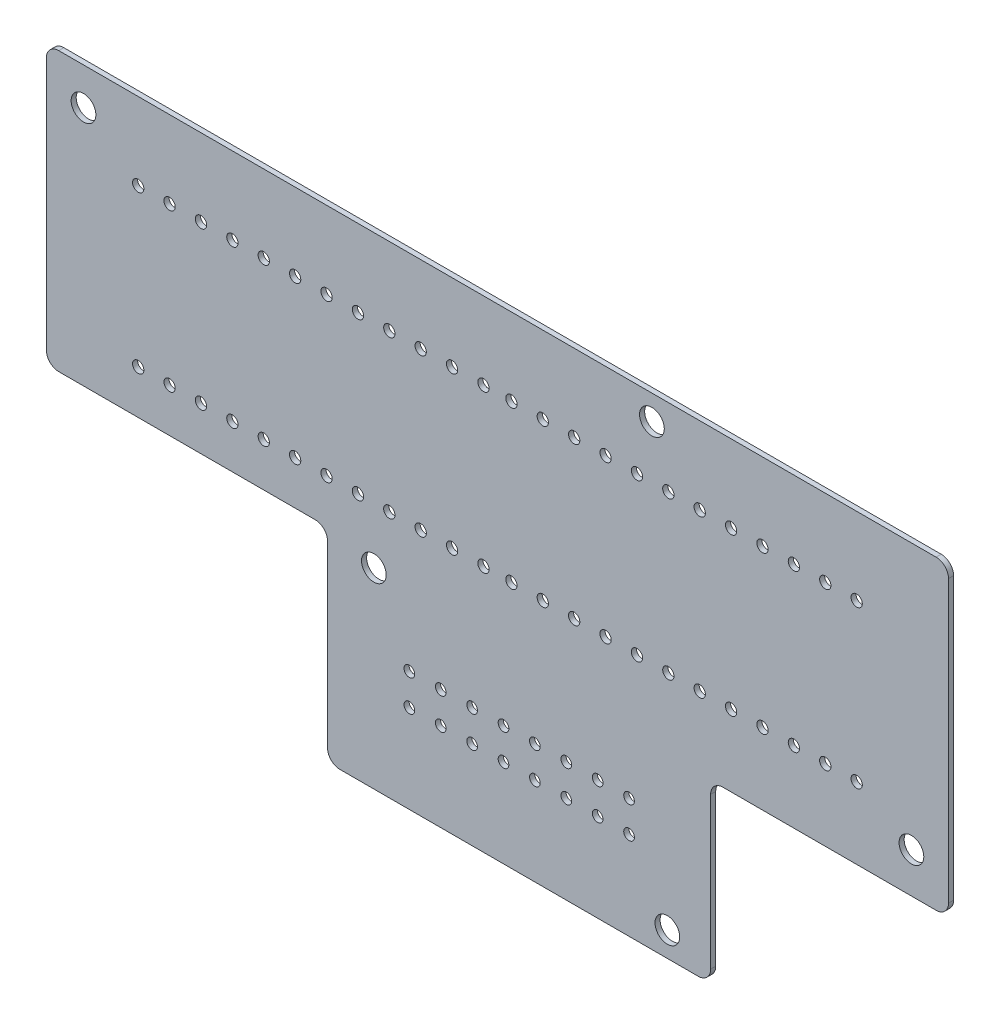
from build123d import *

# Parameters (mm, degrees)
BOARD_DEPTH                        = 0.41148
F_1_0_228_DIAMETER_HOLE1_OUTLINE_R = 0.4572
F_1_0_228_DIAMETER_HOLE1_DEPTH     = 0.41148
F_1_0_228_DIAMETER_HOLE2_OUTLINE_R = 0.4318
F_1_0_228_DIAMETER_HOLE2_DEPTH     = 0.41148
SKETCH6_R                          = 0.999998
CUT_EXTRUDE1_DEPTH                 = 77.389914621
SKETCH7_R                          = 0.999998
CUT_EXTRUDE2_DEPTH                 = 77.389914621
SKETCH8_R                          = 0.999998
CUT_EXTRUDE3_DEPTH                 = 77.389914621
SKETCH9_R                          = 0.999998
CUT_EXTRUDE4_DEPTH                 = 77.389914621
SKETCH10_R                         = 0.999998
CUT_EXTRUDE5_DEPTH                 = 77.389914621


# Read off the part's stored shape, not the designer's step: #1 (0.228) Diameter Hole1, #1 (0.228) Diameter Hole2
with BuildPart() as part:
    # Sketch1 → Board (new body)
    with BuildSketch(Plane.XY):
        with BuildLine():
            Line((0.999998, 22.49999818), (71.99999824, 22.49999564))
            ThreePointArc((71.99999824, 22.49999564), (72.707104877, 22.207103533), (72.99999878, 21.49999764))
            Line((72.99999878, 21.49999764), (72.99999624, -1.2499975))
            ThreePointArc((72.99999624, -1.2499975), (72.707104133, -1.957104137), (71.99999824, -2.24999804))
            Line((71.99999824, -2.24999804), (54.74999972, -2.25000058))
            ThreePointArc((54.74999972, -2.25000058), (54.042893083, -2.542892687), (53.74999918, -3.24999858))
            Line((53.74999918, -3.24999858), (53.74999664, -15.49999948))
            ThreePointArc((53.74999664, -15.49999948), (53.457104007, -16.207104847), (52.74999864, -16.49999748))
            Line((52.74999864, -16.49999748), (23.74999822, -16.49999748))
            ThreePointArc((23.74999822, -16.49999748), (23.042891583, -16.207105373), (22.74999768, -15.49999948))
            Line((22.74999768, -15.49999948), (22.74999768, -0.999998))
            ThreePointArc((22.74999768, -0.999998), (22.457105047, -0.292892633), (21.74999968, 0))
            Line((21.74999968, 0), (0.999998, 0))
            ThreePointArc((0.999998, 0), (0.292892633, 0.292892633), (0, 0.999998))
            Line((0, 0.999998), (-2.54e-06, 21.49999764))
            ThreePointArc((-2.54e-06, 21.49999764), (0.292890837, 22.207104803), (0.999998, 22.49999818))
        make_face()
    extrude(amount=BOARD_DEPTH)

    # #1 (0.228) Diameter Hole1 outline → #1 (0.228) Diameter Hole1 (cut)
    with BuildSketch(Plane.XY):
        with Locations((37.62799942, 16.24500434)):
            Circle(F_1_0_228_DIAMETER_HOLE1_OUTLINE_R)
        with Locations((40.16799942, 16.24500434)):
            Circle(F_1_0_228_DIAMETER_HOLE1_OUTLINE_R)
        with Locations((42.70799942, 16.24500434)):
            Circle(F_1_0_228_DIAMETER_HOLE1_OUTLINE_R)
        with Locations((45.24799942, 16.24500434)):
            Circle(F_1_0_228_DIAMETER_HOLE1_OUTLINE_R)
        with Locations((47.78799942, 16.24500434)):
            Circle(F_1_0_228_DIAMETER_HOLE1_OUTLINE_R)
        with Locations((50.32799942, 16.24500434)):
            Circle(F_1_0_228_DIAMETER_HOLE1_OUTLINE_R)
        with Locations((52.86799942, 16.24500434)):
            Circle(F_1_0_228_DIAMETER_HOLE1_OUTLINE_R)
        with Locations((55.40799942, 16.24500434)):
            Circle(F_1_0_228_DIAMETER_HOLE1_OUTLINE_R)
        with Locations((57.94799942, 16.24500434)):
            Circle(F_1_0_228_DIAMETER_HOLE1_OUTLINE_R)
        with Locations((60.48799942, 16.24500434)):
            Circle(F_1_0_228_DIAMETER_HOLE1_OUTLINE_R)
        with Locations((63.02799942, 16.24500434)):
            Circle(F_1_0_228_DIAMETER_HOLE1_OUTLINE_R)
        with Locations((65.56799942, 16.24500434)):
            Circle(F_1_0_228_DIAMETER_HOLE1_OUTLINE_R)
        with Locations((65.56799942, 3.54500434)):
            Circle(F_1_0_228_DIAMETER_HOLE1_OUTLINE_R)
        with Locations((63.02799942, 3.54500434)):
            Circle(F_1_0_228_DIAMETER_HOLE1_OUTLINE_R)
        with Locations((60.48799942, 3.54500434)):
            Circle(F_1_0_228_DIAMETER_HOLE1_OUTLINE_R)
        with Locations((57.94799942, 3.54500434)):
            Circle(F_1_0_228_DIAMETER_HOLE1_OUTLINE_R)
        with Locations((55.40799942, 3.54500434)):
            Circle(F_1_0_228_DIAMETER_HOLE1_OUTLINE_R)
        with Locations((52.86799942, 3.54500434)):
            Circle(F_1_0_228_DIAMETER_HOLE1_OUTLINE_R)
        with Locations((50.32799942, 3.54500434)):
            Circle(F_1_0_228_DIAMETER_HOLE1_OUTLINE_R)
        with Locations((47.78799942, 3.54500434)):
            Circle(F_1_0_228_DIAMETER_HOLE1_OUTLINE_R)
        with Locations((45.24799942, 3.54500434)):
            Circle(F_1_0_228_DIAMETER_HOLE1_OUTLINE_R)
        with Locations((42.70799942, 3.54500434)):
            Circle(F_1_0_228_DIAMETER_HOLE1_OUTLINE_R)
        with Locations((40.16799942, 3.54500434)):
            Circle(F_1_0_228_DIAMETER_HOLE1_OUTLINE_R)
        with Locations((37.62799942, 3.54500434)):
            Circle(F_1_0_228_DIAMETER_HOLE1_OUTLINE_R)
        with Locations((7.42800902, 16.24500434)):
            Circle(F_1_0_228_DIAMETER_HOLE1_OUTLINE_R)
        with Locations((9.96800902, 16.24500434)):
            Circle(F_1_0_228_DIAMETER_HOLE1_OUTLINE_R)
        with Locations((12.50800902, 16.24500434)):
            Circle(F_1_0_228_DIAMETER_HOLE1_OUTLINE_R)
        with Locations((15.04800902, 16.24500434)):
            Circle(F_1_0_228_DIAMETER_HOLE1_OUTLINE_R)
        with Locations((17.58800902, 16.24500434)):
            Circle(F_1_0_228_DIAMETER_HOLE1_OUTLINE_R)
        with Locations((20.12800902, 16.24500434)):
            Circle(F_1_0_228_DIAMETER_HOLE1_OUTLINE_R)
        with Locations((22.66800902, 16.24500434)):
            Circle(F_1_0_228_DIAMETER_HOLE1_OUTLINE_R)
        with Locations((25.20800902, 16.24500434)):
            Circle(F_1_0_228_DIAMETER_HOLE1_OUTLINE_R)
        with Locations((27.74800902, 16.24500434)):
            Circle(F_1_0_228_DIAMETER_HOLE1_OUTLINE_R)
        with Locations((30.28800902, 16.24500434)):
            Circle(F_1_0_228_DIAMETER_HOLE1_OUTLINE_R)
        with Locations((32.82800902, 16.24500434)):
            Circle(F_1_0_228_DIAMETER_HOLE1_OUTLINE_R)
        with Locations((35.36800902, 16.24500434)):
            Circle(F_1_0_228_DIAMETER_HOLE1_OUTLINE_R)
        with Locations((35.36800902, 3.54500434)):
            Circle(F_1_0_228_DIAMETER_HOLE1_OUTLINE_R)
        with Locations((32.82800902, 3.54500434)):
            Circle(F_1_0_228_DIAMETER_HOLE1_OUTLINE_R)
        with Locations((30.28800902, 3.54500434)):
            Circle(F_1_0_228_DIAMETER_HOLE1_OUTLINE_R)
        with Locations((27.74800902, 3.54500434)):
            Circle(F_1_0_228_DIAMETER_HOLE1_OUTLINE_R)
        with Locations((25.20800902, 3.54500434)):
            Circle(F_1_0_228_DIAMETER_HOLE1_OUTLINE_R)
        with Locations((22.66800902, 3.54500434)):
            Circle(F_1_0_228_DIAMETER_HOLE1_OUTLINE_R)
        with Locations((20.12800902, 3.54500434)):
            Circle(F_1_0_228_DIAMETER_HOLE1_OUTLINE_R)
        with Locations((17.58800902, 3.54500434)):
            Circle(F_1_0_228_DIAMETER_HOLE1_OUTLINE_R)
        with Locations((15.04800902, 3.54500434)):
            Circle(F_1_0_228_DIAMETER_HOLE1_OUTLINE_R)
        with Locations((12.50800902, 3.54500434)):
            Circle(F_1_0_228_DIAMETER_HOLE1_OUTLINE_R)
        with Locations((9.96800902, 3.54500434)):
            Circle(F_1_0_228_DIAMETER_HOLE1_OUTLINE_R)
        with Locations((7.42800902, 3.54500434)):
            Circle(F_1_0_228_DIAMETER_HOLE1_OUTLINE_R)
    extrude(amount=F_1_0_228_DIAMETER_HOLE1_DEPTH, mode=Mode.SUBTRACT)

    # #1 (0.228) Diameter Hole2 outline → #1 (0.228) Diameter Hole2 (cut)
    with BuildSketch(Plane.XY):
        with Locations((47.15000222, -6.81499526)):
            Circle(F_1_0_228_DIAMETER_HOLE2_OUTLINE_R)
        with Locations((47.15000222, -9.35499526)):
            Circle(F_1_0_228_DIAMETER_HOLE2_OUTLINE_R)
        with Locations((44.61000222, -6.81499526)):
            Circle(F_1_0_228_DIAMETER_HOLE2_OUTLINE_R)
        with Locations((44.61000222, -9.35499526)):
            Circle(F_1_0_228_DIAMETER_HOLE2_OUTLINE_R)
        with Locations((42.07000222, -6.81499526)):
            Circle(F_1_0_228_DIAMETER_HOLE2_OUTLINE_R)
        with Locations((42.07000222, -9.35499526)):
            Circle(F_1_0_228_DIAMETER_HOLE2_OUTLINE_R)
        with Locations((39.53000222, -6.81499526)):
            Circle(F_1_0_228_DIAMETER_HOLE2_OUTLINE_R)
        with Locations((39.53000222, -9.35499526)):
            Circle(F_1_0_228_DIAMETER_HOLE2_OUTLINE_R)
        with Locations((36.99000222, -6.81499526)):
            Circle(F_1_0_228_DIAMETER_HOLE2_OUTLINE_R)
        with Locations((36.99000222, -9.35499526)):
            Circle(F_1_0_228_DIAMETER_HOLE2_OUTLINE_R)
        with Locations((34.45000222, -6.81499526)):
            Circle(F_1_0_228_DIAMETER_HOLE2_OUTLINE_R)
        with Locations((34.45000222, -9.35499526)):
            Circle(F_1_0_228_DIAMETER_HOLE2_OUTLINE_R)
        with Locations((31.91000222, -6.81499526)):
            Circle(F_1_0_228_DIAMETER_HOLE2_OUTLINE_R)
        with Locations((31.91000222, -9.35499526)):
            Circle(F_1_0_228_DIAMETER_HOLE2_OUTLINE_R)
        with Locations((29.37000222, -6.81499526)):
            Circle(F_1_0_228_DIAMETER_HOLE2_OUTLINE_R)
        with Locations((29.37000222, -9.35499526)):
            Circle(F_1_0_228_DIAMETER_HOLE2_OUTLINE_R)
    extrude(amount=F_1_0_228_DIAMETER_HOLE2_DEPTH, mode=Mode.SUBTRACT)

    # Sketch6 → Cut-Extrude1 (cut, through all)
    with BuildSketch(Plane.XY.offset(0.41148)):
        with Locations((50.24999856, -14.49999894)):
            Circle(SKETCH6_R)
    extrude(amount=-CUT_EXTRUDE1_DEPTH, mode=Mode.SUBTRACT)

    # Sketch7 → Cut-Extrude2 (cut, through all)
    with BuildSketch(Plane.XY.offset(0.41148)):
        with Locations((2.99999908, 19.4999991)):
            Circle(SKETCH7_R)
    extrude(amount=-CUT_EXTRUDE2_DEPTH, mode=Mode.SUBTRACT)

    # Sketch8 → Cut-Extrude3 (cut, through all)
    with BuildSketch(Plane.XY.offset(0.41148)):
        with Locations((48.99999852, 20.49999964)):
            Circle(SKETCH8_R)
    extrude(amount=-CUT_EXTRUDE3_DEPTH, mode=Mode.SUBTRACT)

    # Sketch9 → Cut-Extrude4 (cut, through all)
    with BuildSketch(Plane.XY.offset(0.41148)):
        with Locations((69.9999997, 0.999998)):
            Circle(SKETCH9_R)
    extrude(amount=-CUT_EXTRUDE4_DEPTH, mode=Mode.SUBTRACT)

    # Sketch10 → Cut-Extrude5 (cut, through all)
    with BuildSketch(Plane.XY.offset(0.41148)):
        with Locations((26.4999978, -0.999998)):
            Circle(SKETCH10_R)
    extrude(amount=-CUT_EXTRUDE5_DEPTH, mode=Mode.SUBTRACT)


solid = part.part
